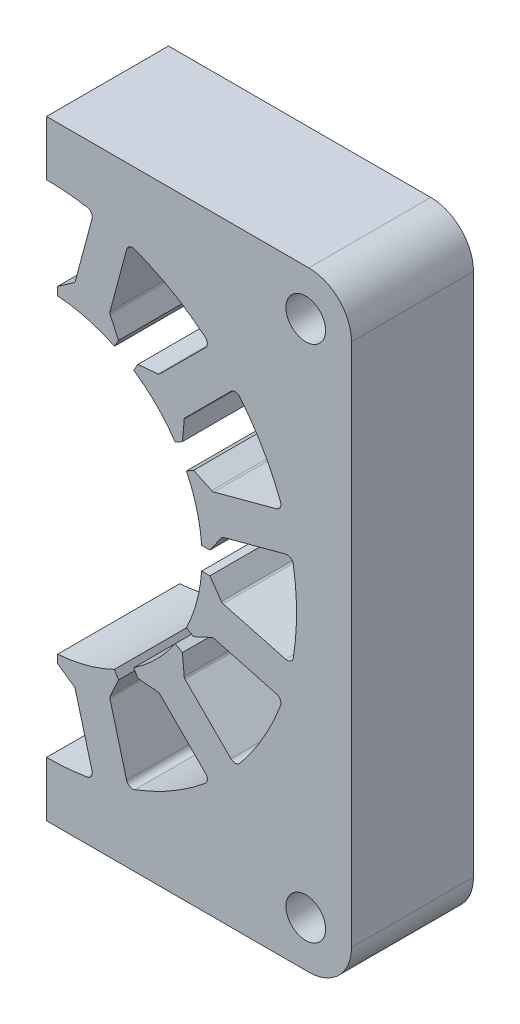
from build123d import *

# Parameters (mm, degrees)
SKETCH1_W                              = 100
SKETCH1_H                              = 100
SKETCH1_R                              = 25.5
LAMINATION_EXTRUCTION_DEPTH            = 20
SLOT_CUT_DEPTH                         = 74.484692283
SLOT_FILLET_TOP_R                      = 1
SLOT_FILLET_BOTTOM_R                   = 0.5
SLOT_DUPLICATE_COUNT                   = 12
SLOT_FILLET_TOP_OF_SLOT_DUPLICATE_R    = 1
SLOT_FILLET_BOTTOM_OF_SLOT_DUPLICATE_R = 0.5
SKETCH3_R                              = 3.25
BOLT_HOLE_CUT_DEPTH                    = 74.484692283
CORNER_FILLET_R                        = 7
SKETCH4_W                              = 50
SKETCH4_H                              = 100
CUT_EXTRUDE1_DEPTH                     = 74.484692283


with BuildPart() as part:
    # Sketch1 → Lamination Extruction (new body)
    with BuildSketch(Plane.XY):
        Rectangle(SKETCH1_W, SKETCH1_H)
        Circle(SKETCH1_R, mode=Mode.SUBTRACT)
    extrude(amount=LAMINATION_EXTRUCTION_DEPTH)

    # Sketch2 → Slot Cut (cut, through all)
    with BuildSketch(Plane.XY.offset(20)):
        with BuildLine():
            Line((4.673479277, 28.779136449), (7.75, 40.260868098))
            ThreePointArc((7.75, 40.260868098), (0, 41), (-7.75, 40.260868098))
            Line((-7.75, 40.260868098), (-4.673479277, 28.779136449))
            Line((-4.673479277, 28.779136449), (-1.825, 26.784609787))
            Line((-1.825, 26.784609787), (-1.825, 25.434609787))
            ThreePointArc((-1.825, 25.434609787), (0, 25.5), (1.825, 25.434609787))
            Line((1.825, 25.434609787), (1.825, 26.784609787))
            Line((1.825, 26.784609787), (4.673479277, 28.779136449))
        make_face()
    slot_cut = extrude(amount=-SLOT_CUT_DEPTH, mode=Mode.SUBTRACT)

    # Slot Fillet Top
    slot_fillet_top_edges = [part.edges().sort_by_distance(p)[0] for p in [
        (7.75, 40.260868098, 10),
        (-7.75, 40.260868098, 10),
    ]]
    fillet(slot_fillet_top_edges, radius=SLOT_FILLET_TOP_R)

    # Slot Fillet Bottom
    slot_fillet_bottom_edges = [part.edges().sort_by_distance(p)[0] for p in [
        (4.673479277, 28.779136449, 10),
        (-4.673479277, 28.779136449, 10),
    ]]
    fillet(slot_fillet_bottom_edges, radius=SLOT_FILLET_BOTTOM_R)

    # Slot Duplicate: Slot Cut ×12 about axis
    slot_duplicate_axis = Axis((0, 0, 20), (0, 0, -1))
    for i in range(1, SLOT_DUPLICATE_COUNT):
        add(slot_cut.rotate(slot_duplicate_axis, i * 360 / SLOT_DUPLICATE_COUNT), mode=Mode.SUBTRACT)

    # Slot Fillet Top of Slot Duplicate
    slot_fillet_top_of_slot_duplicate_edges = [part.edges().sort_by_distance(p)[0] for p in [
        (26.842130928, 30.991934551, 10),
        (13.41873717, 38.741934551, 10),
        (38.741934551, 13.41873717, 10),
        (30.991934551, 26.842130928, 10),
        (40.260868098, -7.75, 10),
        (40.260868098, 7.75, 10),
        (30.991934551, -26.842130928, 10),
        (38.741934551, -13.41873717, 10),
        (13.41873717, -38.741934551, 10),
        (26.842130928, -30.991934551, 10),
        (-7.75, -40.260868098, 10),
        (7.75, -40.260868098, 10),
        (-26.842130928, -30.991934551, 10),
        (-13.41873717, -38.741934551, 10),
        (-38.741934551, -13.41873717, 10),
        (-30.991934551, -26.842130928, 10),
        (-40.260868098, 7.75, 10),
        (-40.260868098, -7.75, 10),
        (-30.991934551, 26.842130928, 10),
        (-38.741934551, 13.41873717, 10),
        (-13.41873717, 38.741934551, 10),
        (-26.842130928, 30.991934551, 10),
    ]]
    fillet(slot_fillet_top_of_slot_duplicate_edges, radius=SLOT_FILLET_TOP_OF_SLOT_DUPLICATE_R)

    # Slot Fillet Bottom of Slot Duplicate
    slot_fillet_bottom_of_slot_duplicate_edges = [part.edges().sort_by_distance(p)[0] for p in [
        (18.436920002, 22.586723625, 10),
        (10.342216447, 27.260202902, 10),
        (27.260202902, 10.342216447, 10),
        (22.586723625, 18.436920002, 10),
        (28.779136449, -4.673479277, 10),
        (28.779136449, 4.673479277, 10),
        (22.586723625, -18.436920002, 10),
        (27.260202902, -10.342216447, 10),
        (10.342216447, -27.260202902, 10),
        (18.436920002, -22.586723625, 10),
        (-4.673479277, -28.779136449, 10),
        (4.673479277, -28.779136449, 10),
        (-18.436920002, -22.586723625, 10),
        (-10.342216447, -27.260202902, 10),
        (-27.260202902, -10.342216447, 10),
        (-22.586723625, -18.436920002, 10),
        (-28.779136449, 4.673479277, 10),
        (-28.779136449, -4.673479277, 10),
        (-22.586723625, 18.436920002, 10),
        (-27.260202902, 10.342216447, 10),
        (-10.342216447, 27.260202902, 10),
        (-18.436920002, 22.586723625, 10),
    ]]
    fillet(slot_fillet_bottom_of_slot_duplicate_edges, radius=SLOT_FILLET_BOTTOM_OF_SLOT_DUPLICATE_R)

    # Sketch3 → Bolt Hole Cut (cut, through all)
    with BuildSketch(Plane.XY.offset(20)):
        with Locations((-42.5, 42.5)):
            Circle(SKETCH3_R)
        with Locations((42.5, 42.5)):
            Circle(SKETCH3_R)
        with Locations((42.5, -42.5)):
            Circle(SKETCH3_R)
        with Locations((-42.5, -42.5)):
            Circle(SKETCH3_R)
    extrude(amount=-BOLT_HOLE_CUT_DEPTH, mode=Mode.SUBTRACT)

    # Corner Fillet
    corner_fillet_edges = [part.edges().sort_by_distance(p)[0] for p in [
        (-50, 50, 10),
        (-50, -50, 10),
        (50, -50, 10),
        (50, 50, 10),
    ]]
    fillet(corner_fillet_edges, radius=CORNER_FILLET_R)

    # Sketch4 → Cut-Extrude1 (cut, through all)
    with BuildSketch(Plane.XY.offset(20)):
        with Locations((-25, 0)):
            Rectangle(SKETCH4_W, SKETCH4_H)
    extrude(amount=-CUT_EXTRUDE1_DEPTH, mode=Mode.SUBTRACT)


solid = part.part
